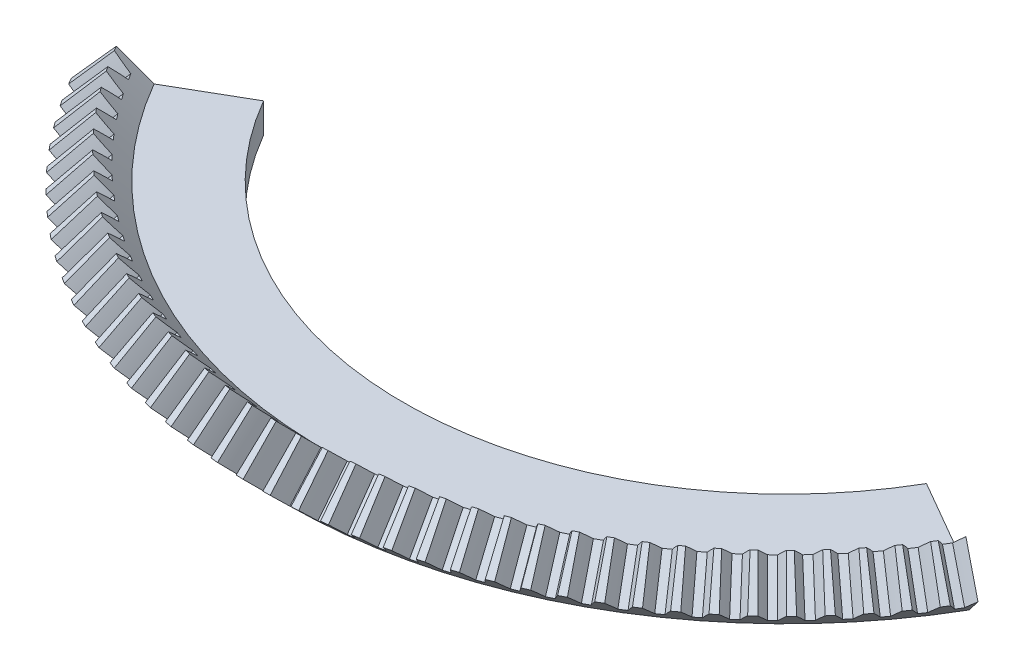
from build123d import *

# Parameters (mm, degrees)
CUT_EXTRUDE1_DEPTH       = 12
CIRPATTERN1_COUNT        = 120
SKETCH17_R               = 90
CUT_EXTRUDE4_DEPTH       = 3
CUT_EXTRUDE8_DEPTH       = 74
CUT_EXTRUDE8_DEPTH_BACK  = 42
SKETCH20_R               = 65
CUT_EXTRUDE9_DEPTH       = 42
CUT_EXTRUDE11_DEPTH      = 47
CUT_EXTRUDE11_DEPTH_BACK = 67
CUT_EXTRUDE13_DEPTH      = 34
CUT_EXTRUDE13_DEPTH_BACK = 56
CUT_EXTRUDE14_DEPTH      = 36
CUT_EXTRUDE14_DEPTH_BACK = 69


with BuildPart() as part:
    # Sketch11 → Revolve1 (revolve)
    with BuildSketch(Plane.XY, mode=Mode.PRIVATE) as revolve1_sk:
        Polygon((0, 120), (0, 111.957812196), (-81.764617026, 111.957812196), (-88.919105998, 118.944462863), (-83.306834375, 124.691556476), (-78.615277899, 120), align=None)
    revolve(revolve1_sk.sketch.rotate(Axis((0, 0, 0), (0, 1, 0)), 270), axis=Axis((0, 0, 0), (0, 1, 0)))

    # Sketch14 → Cut-Extrude1 (cut)
    with BuildSketch(Plane(origin=(0, 16.436731301, -16.051139385), x_dir=(1, 0, 0), z_dir=(0, 0.7154488971806515, -0.6986650667687555))):
        with BuildLine():
            ThreePointArc((-1.040586665, -143.469417413), (-0.552146737, -145.104616252), (0, -146.719417413))
            ThreePointArc((0, -146.719417413), (-1.710680658, -146.707922674), (-3.421052378, -146.673440534))
            ThreePointArc((-3.421052378, -146.673440534), (-2.825708993, -145.074060948), (-2.293501241, -143.452578997))
            ThreePointArc((-2.293501241, -143.452578997), (-1.667065213, -143.462580119), (-1.040586665, -143.469417413))
        make_face()
    cut_extrude1 = extrude(amount=CUT_EXTRUDE1_DEPTH, mode=Mode.SUBTRACT)

    # CirPattern1: Cut-Extrude1 ×120 about axis
    cirpattern1_axis = Axis((0, 118.944462863, 0), (0, -1, 0))
    for i in range(1, CIRPATTERN1_COUNT):
        add(cut_extrude1.rotate(cirpattern1_axis, i * 360 / CIRPATTERN1_COUNT), mode=Mode.SUBTRACT)

    # Sketch17 → Cut-Extrude4 (cut)
    with BuildSketch(Plane.XZ.offset(-111.957812196)):
        Circle(SKETCH17_R)
    extrude(amount=-CUT_EXTRUDE4_DEPTH, mode=Mode.SUBTRACT)

    # Sketch18 → Cut-Extrude8 (cut, two sides: drawn at the far end of the back side and taken through both)
    with BuildSketch(Plane(origin=(0, 120, 0), x_dir=(1, 0, 0), z_dir=(0, 1, 0)).offset(-CUT_EXTRUDE8_DEPTH_BACK)):
        Polygon((-78.615277899, 0), (99.464435217, 0), (99.464435217, 123.938124643), (-125.000613009, 123.938124643), (-125.000613009, 0), align=None)
    extrude(amount=CUT_EXTRUDE8_DEPTH + CUT_EXTRUDE8_DEPTH_BACK, mode=Mode.SUBTRACT)

    # Sketch20 → Cut-Extrude9 (cut)
    with BuildSketch(Plane(origin=(0, 120, 0), x_dir=(1, 0, 0), z_dir=(0, 1, 0))):
        Circle(SKETCH20_R)
    extrude(amount=-CUT_EXTRUDE9_DEPTH, mode=Mode.SUBTRACT)

    # Sketch21 → Cut-Extrude11 (cut, two sides: drawn at the far end of the back side and taken through both)
    with BuildSketch(Plane(origin=(0, 120, 0), x_dir=(1, 0, 0), z_dir=(0, 1, 0)).offset(-CUT_EXTRUDE11_DEPTH_BACK)):
        with BuildLine():
            Line((-56.291651246, -32.5), (-28.837392791, -16.649276491))
            Line((-28.837392791, -16.649276491), (-72.474154007, 58.931811013))
            Line((-72.474154007, 58.931811013), (-137.905466612, 21.155025067))
            Line((-137.905466612, 21.155025067), (-94.268705396, -54.426062437))
            Line((-94.268705396, -54.426062437), (-68.082827786, -39.30763895))
            ThreePointArc((-68.082827786, -39.30763895), (-75.936527264, -20.347131156), (-78.615277899, 0))
            Line((-78.615277899, 0), (-65, 0))
            ThreePointArc((-65, 0), (-62.785178709, -16.823237932), (-56.291651246, -32.5))
        make_face()
    extrude(amount=CUT_EXTRUDE11_DEPTH + CUT_EXTRUDE11_DEPTH_BACK, mode=Mode.SUBTRACT)

    # Sketch22 → Cut-Extrude13 (cut, two sides: drawn at the far end of the back side and taken through both)
    with BuildSketch(Plane(origin=(0, 120, 0), x_dir=(1, 0, 0), z_dir=(0, 1, 0)).offset(-CUT_EXTRUDE13_DEPTH_BACK)):
        Polygon((24.356915784, -14.062471885), (93.323932678, -53.880597654), (124.239554758, -8.761836792), (58.74095932, 36.118159569), align=None)
    extrude(amount=CUT_EXTRUDE13_DEPTH + CUT_EXTRUDE13_DEPTH_BACK, mode=Mode.SUBTRACT)

    # Sketch23 → Cut-Extrude14 (cut, two sides: drawn at the far end of the back side and taken through both)
    with BuildSketch(Plane(origin=(0, 120, 0), x_dir=(1, 0, 0), z_dir=(0, 1, 0)).offset(-CUT_EXTRUDE14_DEPTH_BACK)):
        Polygon((-38.751710967, -22.373310758), (-92.4340517, -53.366824631), (-128.3691599, 8.874608548), (-70.199691681, 38.785475456), align=None)
    extrude(amount=CUT_EXTRUDE14_DEPTH + CUT_EXTRUDE14_DEPTH_BACK, mode=Mode.SUBTRACT)


solid = part.part
